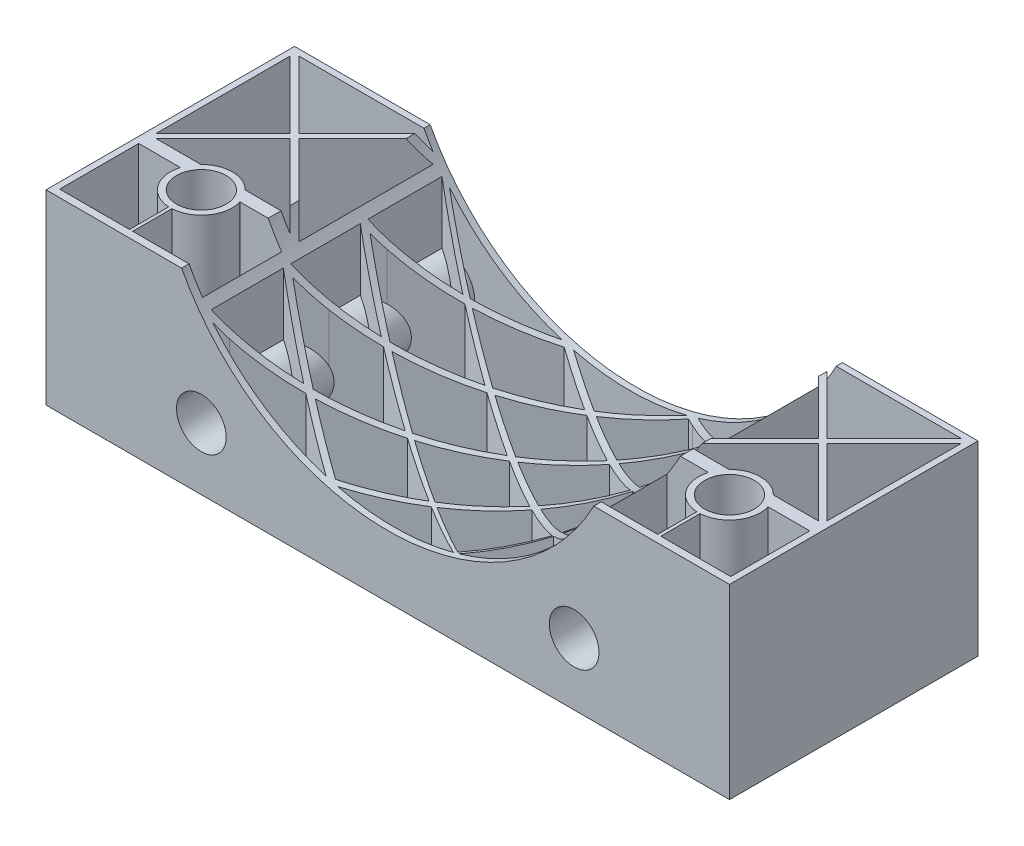
from build123d import *

# Parameters (mm, degrees)
SKETCH1_W           = 110
SKETCH1_H           = 40
BOSS_EXTRUDE1_DEPTH = 30
SKETCH2_R           = 37.5
CUT_EXTRUDE1_DEPTH  = 40
SKETCH3_R           = 4
CUT_EXTRUDE3_DEPTH  = 30
SKETCH7_R           = 4
CUT_EXTRUDE6_DEPTH  = 40
CUT_EXTRUDE7_DEPTH  = 30
CUT_EXTRUDE9_DEPTH  = 30
SKETCH12_R          = 5
BOSS_EXTRUDE3_DEPTH = 40
SKETCH15_R          = 4
CUT_EXTRUDE10_DEPTH = 40


with BuildPart() as part:
    # Sketch1 → Boss-Extrude1 (new body)
    with BuildSketch(Plane(origin=(0, 0, 0), x_dir=(1, 0, 0), z_dir=(0, 1, 0))):
        with Locations((55, 20)):
            Rectangle(SKETCH1_W, SKETCH1_H)
    extrude(amount=BOSS_EXTRUDE1_DEPTH)

    # Sketch2 → Cut-Extrude1 (cut)
    with BuildSketch(Plane.XY):
        with Locations((55, 47.5)):
            Circle(SKETCH2_R)
    extrude(amount=-CUT_EXTRUDE1_DEPTH, mode=Mode.SUBTRACT)

    # Sketch3 → Cut-Extrude3 (cut)
    with BuildSketch(Plane.XZ):
        with Locations((12.5, -12.5)):
            Circle(SKETCH3_R)
    cut_extrude3 = extrude(amount=-CUT_EXTRUDE3_DEPTH, mode=Mode.SUBTRACT)

    # Mirror1: Cut-Extrude3 across plane
    add(cut_extrude3.mirror(Plane(origin=(55, 0, 0), x_dir=(0, 0, 1), z_dir=(1, 0, 0))), mode=Mode.SUBTRACT)

    # Sketch7 → Cut-Extrude6 (cut)
    with BuildSketch(Plane.XY):
        with Locations((25, 10)):
            Circle(SKETCH7_R)
        with Locations((85, 10)):
            Circle(SKETCH7_R)
    extrude(amount=-CUT_EXTRUDE6_DEPTH, mode=Mode.SUBTRACT)

    # Sketch9 → Cut-Extrude7 (cut)
    with BuildSketch(Plane.XZ):
        Polygon((1.707106781, -39), (12.5, -28.207106781), (23.292893219, -39), (21.79125531, -39), align=None)
        Polygon((1, -16.707106781), (11.792893219, -27.5), (1, -38.292893219), (1, -36.79125531), align=None)
        with BuildLine():
            Line((23.292893219, -16), (12.5, -26.792893219))
            Line((12.5, -26.792893219), (1.707106781, -16))
            Line((1.707106781, -16), (8.929285786, -16))
            ThreePointArc((8.929285786, -16), (12.5, -17.5), (16.070714214, -16))
            Line((16.070714214, -16), (23.292893219, -16))
        make_face()
        Polygon((24, -38.292893219), (13.207106781, -27.5), (24, -16.707106781), (24, -18.20874469), align=None)
        with BuildLine():
            Line((12.25, -1.199621128), (1, -1.199621128))
            Line((1, -1.199621128), (1, -13.924921606))
            Line((1, -13.924921606), (7.707339109, -13.924921606))
            Line((7.707339109, -13.924921606), (7.68918539, -13.862373953))
            ThreePointArc((7.68918539, -13.862373953), (8.437608263, -9.585043161), (12.25, -7.506253911))
            Line((12.25, -7.506253911), (12.25, -1.199621128))
        make_face()
        with BuildLine():
            Line((17.292660891, -13.924921606), (17.31081461, -13.862373953))
            ThreePointArc((17.31081461, -13.862373953), (16.562391737, -9.585043161), (12.75, -7.506253911))
            Line((12.75, -7.506253911), (12.75, -1.199621128))
            Line((12.75, -1.199621128), (24, -1.199621128))
            Line((24, -1.199621128), (24, -13.924921606))
            Line((24, -13.924921606), (17.292660891, -13.924921606))
        make_face()
        with BuildLine():
            Line((97.25, -1.199621128), (86, -1.199621128))
            Line((86, -1.199621128), (86, -13.924921606))
            Line((86, -13.924921606), (92.707339109, -13.924921606))
            Line((92.707339109, -13.924921606), (92.68918539, -13.862373953))
            ThreePointArc((92.68918539, -13.862373953), (93.437608263, -9.585043161), (97.25, -7.506253911))
            Line((97.25, -7.506253911), (97.25, -1.199621128))
        make_face()
        with BuildLine():
            Line((102.292660891, -13.924921606), (102.31081461, -13.862373953))
            ThreePointArc((102.31081461, -13.862373953), (101.562391737, -9.585043161), (97.75, -7.506253911))
            Line((97.75, -7.506253911), (97.75, -1.199621128))
            Line((97.75, -1.199621128), (109, -1.199621128))
            Line((109, -1.199621128), (109, -13.924921606))
            Line((109, -13.924921606), (102.292660891, -13.924921606))
        make_face()
        with BuildLine():
            Line((93.929285786, -16), (86.707106781, -16))
            Line((86.707106781, -16), (97.5, -26.792893219))
            Line((97.5, -26.792893219), (108.292893219, -16))
            Line((108.292893219, -16), (101.070714214, -16))
            ThreePointArc((101.070714214, -16), (97.5, -17.5), (93.929285786, -16))
        make_face()
        Polygon((86, -38.292893219), (86, -18.20874469), (86, -16.707106781), (96.792893219, -27.5), align=None)
        Polygon((109, -16.707106781), (109, -36.79125531), (109, -38.292893219), (98.207106781, -27.5), align=None)
        Polygon((86.707106781, -39), (88.20874469, -39), (108.292893219, -39), (97.5, -28.207106781), align=None)
    extrude(amount=-CUT_EXTRUDE7_DEPTH, mode=Mode.SUBTRACT)

    # Sketch11 → Cut-Extrude9 (cut)
    with BuildSketch(Plane.XZ):
        Polygon((74.831777691, -6.870491009), (84.013970911, -1), (65.436435115, -1), align=None)
        Polygon((85, -13.007711008), (85, -1.591842697), (75.754730915, -7.447179784), (84.828397962, -13.116678302), align=None)
        Polygon((74.303109193, -7.20848691), (65.00347679, -1.276449032), (55.748894389, -7.18560979), (65.113625115, -13.083639214), align=None)
        Polygon((55.184396802, -6.830081855), (64.570088732, -1), (45.92755138, -1), align=None)
        Polygon((75.037558184, -19.333861561), (84.195449509, -13.51860057), (75.214092745, -7.789583958), (65.986768251, -13.633556138), align=None)
        Polygon((85, -25.608337217), (85, -14.03180623), (81.349745928, -16.510200328), (75.974121895, -19.923721588), align=None)
        Polygon((47.722877132, -3.306365214), (45.005975516, -1.589808553), (35.983357785, -7.364283901), (45.064941258, -13.115953433), (54.24364247, -7.414447377), align=None)
        Polygon((64.184872748, -13.677422452), (54.820920186, -7.778132338), (45.765881351, -13.559882159), (55.111159638, -19.478558407), align=None)
        Polygon((74.104156828, -19.926571422), (65.053474994, -14.224641867), (55.934488469, -20), (64.973366916, -25.724623017), align=None)
        Polygon((35.050950115, -6.773759043), (44.07244862, -1), (25.860015592, -1), (27.529634929, -2.010259425), align=None)
        Polygon((80.649584856, -28.390632809), (84.068474608, -26.204091624), (75.040582112, -20.516519351), (65.907331161, -26.316133705), (74.946238074, -32.04077475), align=None)
        Polygon((54.181077526, -20.073191796), (44.835197816, -14.154134647), (35.728490581, -19.968875355), (45.103769575, -25.876626056), align=None)
        Polygon((85, -38.408157303), (85, -26.790952621), (82.228397155, -28.567458704), (75.878645743, -32.631299607), align=None)
        Polygon((64.040106421, -26.31724343), (55, -20.591842697), (45.881647659, -26.36679918), (54.956574992, -32.085285888), align=None)
        Polygon((44.12138996, -13.702056338), (35.053761926, -7.95922525), (28.423168594, -12.202804983), (25.932883022, -13.794637913), (29.509301375, -16.049907246), (34.886630018, -19.438384226), align=None)
        Polygon((34.121354257, -7.368700393), (25, -1.591842697), (25, -13.206367117), align=None)
        Polygon((44.174383673, -26.470814335), (34.797457648, -20.563350939), (25.961839119, -26.204998289), (27.626895365, -27.28758015), (35.257903909, -32.171425619), align=None)
        Polygon((66.85354378, -37.220099098), (74.016642215, -32.635716099), (64.974070666, -26.908754119), (55.892895673, -32.67530024), (64.990420354, -38.408026471), align=None)
        Polygon((54.025105444, -32.676769051), (44.947934097, -26.958151102), (35.983357785, -32.635716099), (45.001054032, -38.407041698), align=None)
        Polygon((25, -25.579632277), (33.942595105, -20.024787537), (25, -14.390952621), align=None)
        Polygon((65.929850142, -39), (84.065511531, -39), (74.949049885, -33.226240957), (67.451195268, -38.024867912), align=None)
        Polygon((25, -38.729655361), (34.329869874, -32.764749603), (26.854833561, -27.980726362), (25, -26.819143988), align=None)
        Polygon((64.061979967, -39), (54.961530728, -33.26671698), (47.140316953, -38.233187727), (45.92755138, -39), align=None)
        Polygon((42.539405901, -38.01885266), (35.050950115, -33.226240957), (25.934488469, -39), (44.06726143, -39), align=None)
    extrude(amount=-CUT_EXTRUDE9_DEPTH, mode=Mode.SUBTRACT)

    # Sketch12 → Boss-Extrude3 (add)
    with BuildSketch(Plane.XY):
        with Locations((25, 10)):
            Circle(SKETCH12_R)
        with Locations((85, 10)):
            Circle(SKETCH12_R)
    extrude(amount=-BOSS_EXTRUDE3_DEPTH)

    # Sketch15 → Cut-Extrude10 (cut)
    with BuildSketch(Plane.XY):
        with Locations((25, 10)):
            Circle(SKETCH15_R)
        with Locations((85, 10)):
            Circle(SKETCH15_R)
    extrude(amount=-CUT_EXTRUDE10_DEPTH, mode=Mode.SUBTRACT)


solid = part.part
